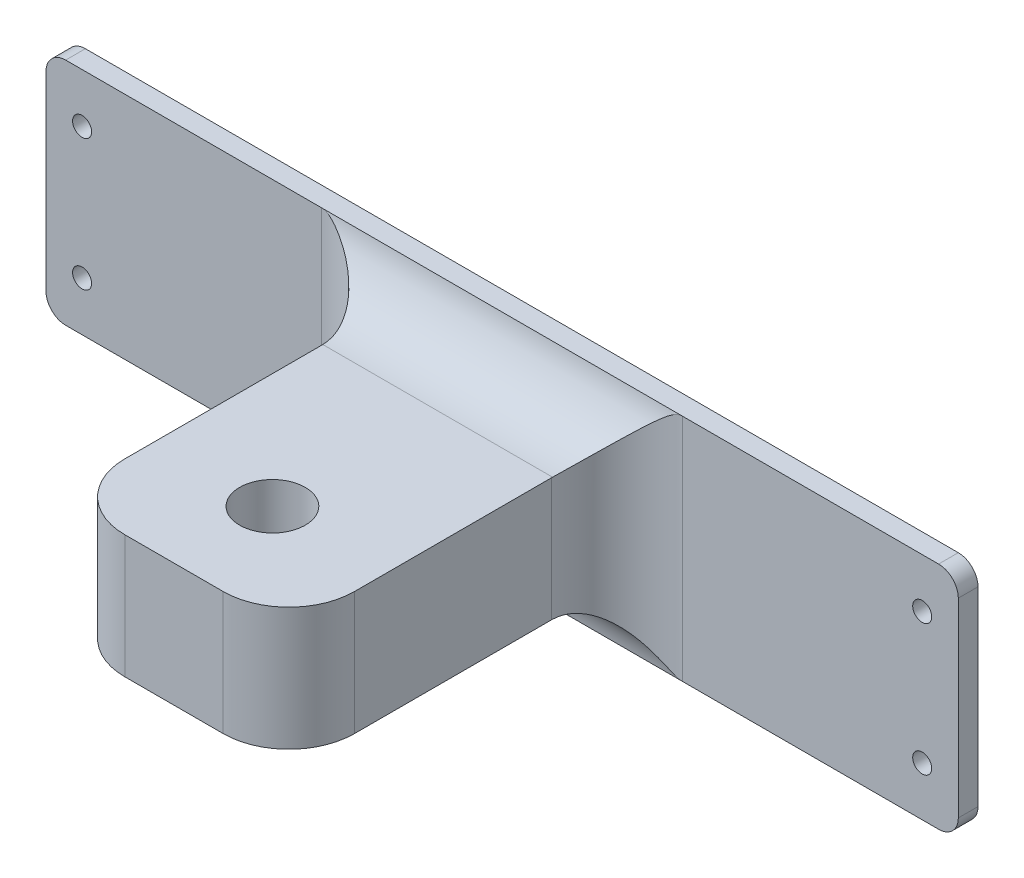
from build123d import *

# Parameters (mm, degrees)
ESQUISSE7_W             = 139
ESQUISSE7_H             = 35
BOSS_EXTRU_1_DEPTH      = 3
ESQUISSE8_W             = 35
ESQUISSE8_H             = 18.75
BOSS_EXTRU_2_DEPTH      = 50
CONG_1_R                = 10
D_GAGEMENT_M2_52_D      = 2.9
ESQUISSE9_R             = 5
ENL_V_MAT_EXTRU_2_DEPTH = 90.73581019
CONG_2_R                = 3


with BuildPart() as part:
    # Esquisse7 → Boss.-Extru.1 (new body)
    with BuildSketch(Plane.XY):
        Rectangle(ESQUISSE7_W, ESQUISSE7_H)
    extrude(amount=-BOSS_EXTRU_1_DEPTH)

    # Esquisse8 → Boss.-Extru.2 (add)
    with BuildSketch(Plane.XY):
        Rectangle(ESQUISSE8_W, ESQUISSE8_H)
    extrude(amount=BOSS_EXTRU_2_DEPTH)

    # Congé1
    # the kernel refuses this fillet: 10 mm, written as the material it adds along each edge
    with BuildSketch(Plane(origin=(17.5, 9.375, 0), x_dir=(1, 0, 0), z_dir=(0, -1, 0)), Plane(origin=(-17.5, -9.375, 0), x_dir=(-1, 0, 0), z_dir=(0, 1, 0))) as cong_1_piece_1:
        with BuildLine():
            CenterArc((CONG_1_R, CONG_1_R), CONG_1_R, 180, 90)
            Line((0, CONG_1_R), (0, 0))
            Line((0, 0), (CONG_1_R, 0))
        make_face()
    extrude(amount=18.75)
    with BuildSketch(Plane(origin=(-17.5, 9.375, 0), x_dir=(0, 1, 0), z_dir=(1, 0, 0)), Plane(origin=(17.5, -9.375, 0), x_dir=(0, -1, 0), z_dir=(-1, 0, 0))) as cong_1_piece_2:
        with BuildLine():
            CenterArc((10, 9.822646028), CONG_1_R, 180, 79.193077125)
            Line((0, 9.822646028), (0, 0))
            Line((0, 0), (8.125, 0))
        make_face()
    extrude(amount=35)
    with BuildSketch(Plane(origin=(-17.5, 9.375, 0), x_dir=(0, 1, 0), z_dir=(1, 0, 0))) as cong_1_piece_3a_section:
        with BuildLine():
            CenterArc((10, 9.822646028), CONG_1_R, 180, 79.193077125)
            Line((0, 9.822646028), (0, 0))
            Line((0, 0), (8.125, 0))
        make_face()
    cong_1_piece_3a = extrude(amount=59.556615071, mode=Mode.PRIVATE)
    cong_1_piece_3a = split(cong_1_piece_3a, bisect_by=Plane(origin=(17.5, 9.375, 0), z_dir=(1, 0, 0)), keep=Keep.TOP, mode=Mode.PRIVATE)
    with BuildSketch(Plane(origin=(17.5, 34.375, 0), x_dir=(1, 0, 0), z_dir=(0, -1, 0))) as cong_1_piece_3b_section:
        with BuildLine():
            CenterArc((CONG_1_R, CONG_1_R), CONG_1_R, 180, 90)
            Line((0, CONG_1_R), (0, 0))
            Line((0, 0), (CONG_1_R, 0))
        make_face()
    cong_1_piece_3b = extrude(amount=43.75, mode=Mode.PRIVATE)
    cong_1_piece_3b = split(cong_1_piece_3b, bisect_by=Plane(origin=(17.5, 17.5, 0), z_dir=(0, -1, 0)), keep=Keep.TOP, mode=Mode.PRIVATE)
    cong_1_piece_3b = split(cong_1_piece_3b, bisect_by=Plane(origin=(17.5, 9.375, 0), z_dir=(0, 1, 0)), keep=Keep.TOP, mode=Mode.PRIVATE)
    cong_1_piece_3 = cong_1_piece_3a & cong_1_piece_3b
    add(cong_1_piece_3)
    with BuildSketch(Plane(origin=(17.5, 9.375, 0), x_dir=(1, 0, 0), z_dir=(0, -1, 0))) as cong_1_piece_4a_section:
        with BuildLine():
            CenterArc((CONG_1_R, CONG_1_R), CONG_1_R, 180, 90)
            Line((0, CONG_1_R), (0, 0))
            Line((0, 0), (CONG_1_R, 0))
        make_face()
    cong_1_piece_4a = extrude(amount=43.75, mode=Mode.PRIVATE)
    cong_1_piece_4a = split(cong_1_piece_4a, bisect_by=Plane(origin=(17.5, -17.5, 0), z_dir=(0, 1, 0)), keep=Keep.TOP, mode=Mode.PRIVATE)
    cong_1_piece_4a = split(cong_1_piece_4a, bisect_by=Plane(origin=(17.5, -9.375, 0), z_dir=(0, -1, 0)), keep=Keep.TOP, mode=Mode.PRIVATE)
    with BuildSketch(Plane(origin=(42.056615071, -9.375, 0), x_dir=(0, -1, 0), z_dir=(-1, 0, 0))) as cong_1_piece_4b_section:
        with BuildLine():
            CenterArc((10, 9.822646028), CONG_1_R, 180, 79.193077125)
            Line((0, 9.822646028), (0, 0))
            Line((0, 0), (8.125, 0))
        make_face()
    cong_1_piece_4b = extrude(amount=59.556615071, mode=Mode.PRIVATE)
    cong_1_piece_4b = split(cong_1_piece_4b, bisect_by=Plane(origin=(17.5, -9.375, 0), z_dir=(1, 0, 0)), keep=Keep.TOP, mode=Mode.PRIVATE)
    cong_1_piece_4 = cong_1_piece_4a & cong_1_piece_4b
    add(cong_1_piece_4)
    with BuildSketch(Plane(origin=(-42.056615071, 9.375, 0), x_dir=(0, 1, 0), z_dir=(1, 0, 0))) as cong_1_piece_5a_section:
        with BuildLine():
            CenterArc((10, 9.822646028), CONG_1_R, 180, 79.193077125)
            Line((0, 9.822646028), (0, 0))
            Line((0, 0), (8.125, 0))
        make_face()
    cong_1_piece_5a = extrude(amount=59.556615071, mode=Mode.PRIVATE)
    cong_1_piece_5a = split(cong_1_piece_5a, bisect_by=Plane(origin=(-17.5, 9.375, 0), z_dir=(-1, 0, 0)), keep=Keep.TOP, mode=Mode.PRIVATE)
    with BuildSketch(Plane(origin=(-17.5, -9.375, 0), x_dir=(-1, 0, 0), z_dir=(0, 1, 0))) as cong_1_piece_5b_section:
        with BuildLine():
            CenterArc((CONG_1_R, CONG_1_R), CONG_1_R, 180, 90)
            Line((0, CONG_1_R), (0, 0))
            Line((0, 0), (CONG_1_R, 0))
        make_face()
    cong_1_piece_5b = extrude(amount=43.75, mode=Mode.PRIVATE)
    cong_1_piece_5b = split(cong_1_piece_5b, bisect_by=Plane(origin=(-17.5, 17.5, 0), z_dir=(0, -1, 0)), keep=Keep.TOP, mode=Mode.PRIVATE)
    cong_1_piece_5b = split(cong_1_piece_5b, bisect_by=Plane(origin=(-17.5, 9.375, 0), z_dir=(0, 1, 0)), keep=Keep.TOP, mode=Mode.PRIVATE)
    cong_1_piece_5 = cong_1_piece_5a & cong_1_piece_5b
    add(cong_1_piece_5)
    with BuildSketch(Plane(origin=(17.5, -9.375, 0), x_dir=(0, -1, 0), z_dir=(-1, 0, 0))) as cong_1_piece_6a_section:
        with BuildLine():
            CenterArc((10, 9.822646028), CONG_1_R, 180, 79.193077125)
            Line((0, 9.822646028), (0, 0))
            Line((0, 0), (8.125, 0))
        make_face()
    cong_1_piece_6a = extrude(amount=59.556615071, mode=Mode.PRIVATE)
    cong_1_piece_6a = split(cong_1_piece_6a, bisect_by=Plane(origin=(-17.5, -9.375, 0), z_dir=(-1, 0, 0)), keep=Keep.TOP, mode=Mode.PRIVATE)
    with BuildSketch(Plane(origin=(-17.5, -34.375, 0), x_dir=(-1, 0, 0), z_dir=(0, 1, 0))) as cong_1_piece_6b_section:
        with BuildLine():
            CenterArc((CONG_1_R, CONG_1_R), CONG_1_R, 180, 90)
            Line((0, CONG_1_R), (0, 0))
            Line((0, 0), (CONG_1_R, 0))
        make_face()
    cong_1_piece_6b = extrude(amount=43.75, mode=Mode.PRIVATE)
    cong_1_piece_6b = split(cong_1_piece_6b, bisect_by=Plane(origin=(-17.5, -17.5, 0), z_dir=(0, 1, 0)), keep=Keep.TOP, mode=Mode.PRIVATE)
    cong_1_piece_6b = split(cong_1_piece_6b, bisect_by=Plane(origin=(-17.5, -9.375, 0), z_dir=(0, -1, 0)), keep=Keep.TOP, mode=Mode.PRIVATE)
    cong_1_piece_6 = cong_1_piece_6a & cong_1_piece_6b
    add(cong_1_piece_6)
    # the kernel refuses this fillet: 10 mm, written as the material it takes off along each edge
    with BuildSketch(Plane(origin=(17.5, 34.375, 50), x_dir=(-1, 0, 0), z_dir=(0, -1, 0))) as cong_1_2_piece_1:
        with BuildLine():
            CenterArc((CONG_1_R, CONG_1_R), CONG_1_R, 180, 90)
            Line((0, CONG_1_R), (0, 0))
            Line((0, 0), (CONG_1_R, 0))
        make_face()
    extrude(amount=68.75, mode=Mode.SUBTRACT)
    with BuildSketch(Plane(origin=(-17.5, -34.375, 50), x_dir=(0, 0, -1), z_dir=(0, 1, 0))) as cong_1_2_piece_2:
        with BuildLine():
            CenterArc((CONG_1_R, -CONG_1_R), CONG_1_R, 90, 90)
            Line((0, -CONG_1_R), (0, 0))
            Line((0, 0), (CONG_1_R, 0))
        make_face()
    extrude(amount=68.75, mode=Mode.SUBTRACT)

    # Dégagement M2.52 (through all)
    with Locations(Plane.XY):
        with Locations((64, -10), (64, 10), (-64, -10), (-64, 10)):
            Hole(D_GAGEMENT_M2_52_D / 2)

    # Esquisse9 → Enlèv. mat.-Extru.2 (cut, through all)
    with BuildSketch(Plane(origin=(0, -9.375, 0), x_dir=(-1, 0, 0), z_dir=(0, -1, 0))):
        with Locations(Location((0, -35, 0), (0, 0, 90))):
            Circle(ESQUISSE9_R)
    extrude(amount=-ENL_V_MAT_EXTRU_2_DEPTH, mode=Mode.SUBTRACT)

    # Congé2
    cong_2_edges = [part.edges().sort_by_distance(p)[0] for p in [
        (-69.5, 17.5, -1.5),
        (69.5, 17.5, -1.5),
        (69.5, -17.5, -1.5),
        (-69.5, -17.5, -1.5),
    ]]
    fillet(cong_2_edges, radius=CONG_2_R)


solid = part.part
